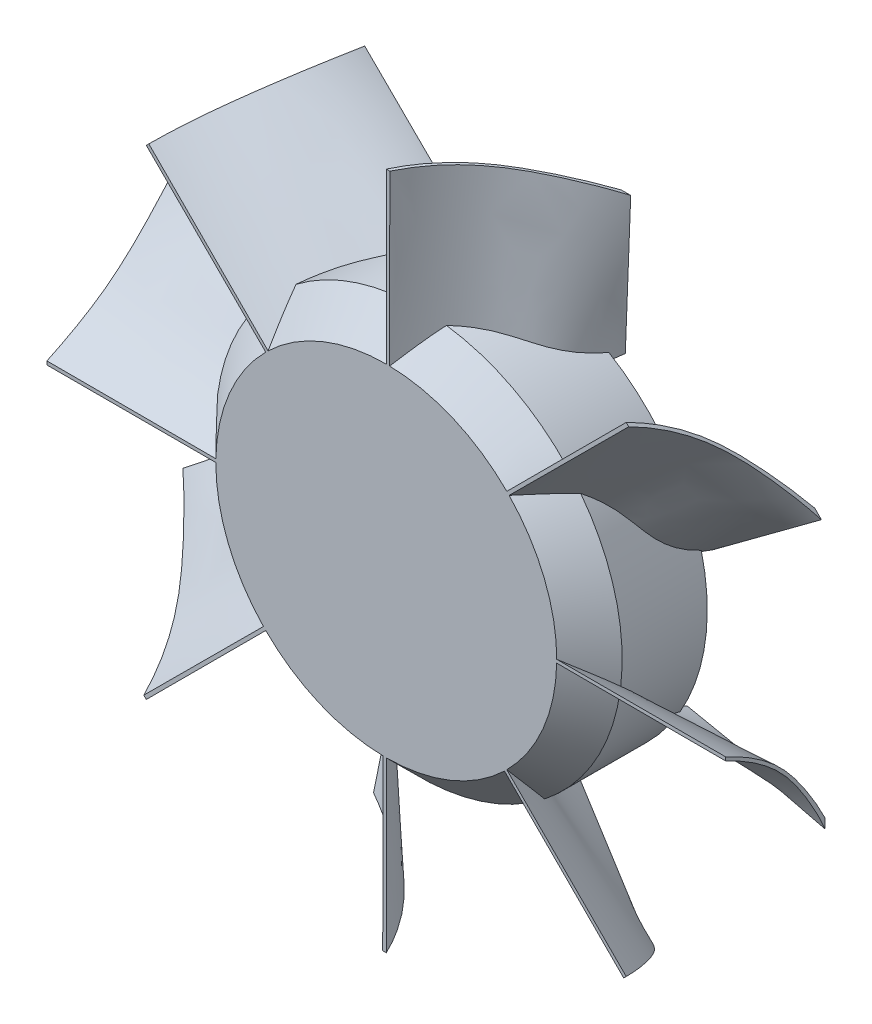
from build123d import *

# Parameters (mm, degrees)
SKETCH1_R          = 31.05
BASE_EXTRUDE_DEPTH = 9
CHAMFER1_SIZE      = 5
CUT_EXTRUDE1_DEPTH = 28.3
CIRPATTERN1_COUNT  = 8
SKETCH10_R         = 5
CUT_EXTRUDE2_DEPTH = 6


with BuildPart() as part:
    # Sketch1 → Base-Extrude (new, symmetric)
    with BuildSketch(Plane.XY):
        Circle(SKETCH1_R)
    extrude(amount=BASE_EXTRUDE_DEPTH, both=True)

    # Chamfer1
    chamfer1_edges = [part.edges().sort_by_distance(p)[0] for p in [
        (-31.05, 0, 9),
    ]]
    chamfer(chamfer1_edges, length=CHAMFER1_SIZE)

    # Boss-Loft6: read off the stored shape, not the designer's step
    # Boss-Loft6: loft between two sections, ruled curve by curve
    boss_loft6_from = [
        Edge.make_bspline([(16, 25, -11), (15.692030403, 25, -9.994590337), (14.816192928, 25, -7.135296856), (12.263183266, 25, -2.464915341), (5.526046889, 25, 1.496520141), (2.123479056, 25, 6.116658138), (0, 25, 9)], [0, 0, 0, 0, 0.121502227, 0.345541263, 0.591564522, 1, 1, 1, 1], 3),
        Edge.make_bspline([(0.5, 25, 9), (2.623479056, 25, 6.116658138), (6.026046889, 25, 1.496520141), (12.763183266, 25, -2.464915341), (15.316192928, 25, -7.135296856), (16.192030403, 25, -9.994590337), (16.5, 25, -11)], [0, 0, 0, 0, 0.408435478, 0.654458737, 0.878497773, 1, 1, 1, 1], 3),
        Edge.make_line((16, 25, -11), (16.5, 25, -11)),
        Edge.make_line((0.5, 25, 9), (0, 25, 9)),
    ]
    boss_loft6_to = [
        Edge.make_bspline([(18.715439716, 55, -8.17035768), (17.735564343, 55, -7.834918032), (14.959562246, 55, -6.730311963), (10.457989242, 55, -4.152364178), (4.593131906, 55, 0.950425562), (1.429639998, 55, 5.762905355), (0, 55, 9)], [0, 0, 0, 0, 0.121502227, 0.345541263, 0.591564522, 1, 1, 1, 1], 3, [1, 0.993204263, 0.976226012, 0.958592199, 0.955501877, 0.977155808, 1]),
        Edge.make_bspline([(0.547449045, 55, 9), (2.051574479, 55, 5.658600348), (5.410032415, 55, 0.718125943), (11.654877906, 55, -4.391355515), (16.427749999, 55, -6.871485269), (19.353396097, 55, -7.875314229), (20.382505708, 55, -8.17035768)], [0, 0, 0, 0, 0.408435478, 0.654458737, 0.878497773, 1, 1, 1, 1], 3, [1, 0.974721282, 0.950759673, 0.954179333, 0.973692398, 0.992480035, 1]),
        Edge.make_line((18.715439716, 55, -8.17035768), (20.382505708, 55, -8.17035768)),
        Edge.make_line((0.547449045, 55, 9), (0, 55, 9)),
    ]
    boss_loft6 = Solid(Shell([*[Face.make_surface_from_curves(boss_loft6_from[k], boss_loft6_to[k]) for k in range(4)], Face(Wire(boss_loft6_from)), Face(Wire(boss_loft6_to))]))
    add(boss_loft6)

    # Sketch9 → Cut-Extrude1 (cut, symmetric)
    with BuildSketch(Plane(origin=(0, 0, 0), x_dir=(0, 0, -1), z_dir=(1, 0, 0))):
        with BuildLine():
            Line((20, 55), (-9, 55))
            Line((-9, 55), (-9, 51.858520464))
            ThreePointArc((-9, 51.858520464), (5.891319815, 50.083884534), (20, 45))
            Line((20, 45), (20, 55))
        make_face()
    cut_extrude1 = extrude(amount=CUT_EXTRUDE1_DEPTH, both=True, mode=Mode.SUBTRACT)

    # CirPattern1: Boss-Loft6, Cut-Extrude1 ×8 about axis
    cirpattern1_axis = Axis((0, 0, 59), (0, 0, -1))
    add([boss_loft6.rotate(cirpattern1_axis, i * 360 / CIRPATTERN1_COUNT) for i in range(1, CIRPATTERN1_COUNT)])
    add([cut_extrude1.rotate(cirpattern1_axis, i * 360 / CIRPATTERN1_COUNT) for i in range(1, CIRPATTERN1_COUNT)], mode=Mode.SUBTRACT)

    # Sketch10 → Cut-Extrude2 (cut)
    with BuildSketch(Plane(origin=(0, 0, -9), x_dir=(-1, 0, 0), z_dir=(0, 0, -1))):
        Circle(SKETCH10_R)
    extrude(amount=-CUT_EXTRUDE2_DEPTH, mode=Mode.SUBTRACT)

    # Sketch11 → Cut-Revolve1 (revolve, cut)
    with BuildSketch(Plane(origin=(0, 0, 0), x_dir=(1, 0, 0), z_dir=(0, 1, 0))):
        Polygon((-24.782136765, 9), (-29.982494522, 9), (-31.056521452, 12.043302135), (-24.782136765, 12.043302135), align=None)
    revolve(axis=Axis((0, 0, -28.762596484), (0, 0, 1)), mode=Mode.SUBTRACT)


solid = part.part
